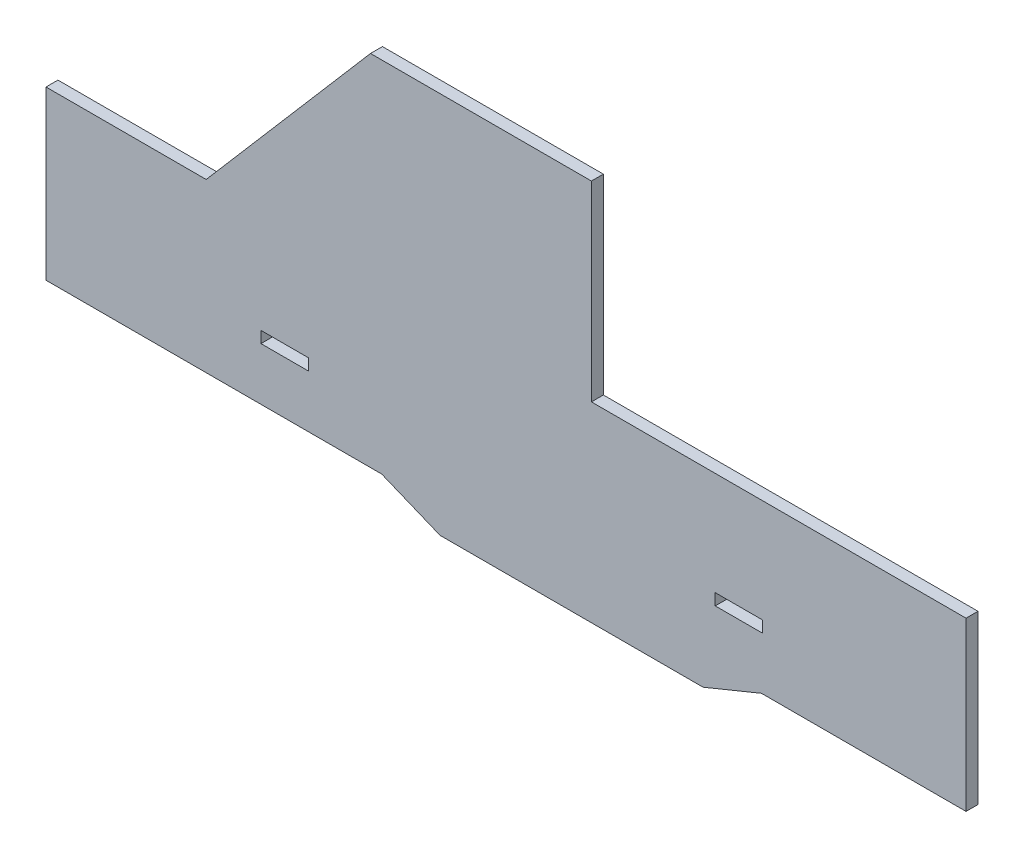
from build123d import *

# Parameters (mm, degrees)
MAIN_SIDE_DEPTH          = 3.175
SKETCH2_W                = 12.573
SKETCH2_H                = 3.048
BOTTOM_PLATE_HOLES_DEPTH = 229.888774204


with BuildPart() as part:
    # Sketch1 → Main Side (new body)
    with BuildSketch(Plane.XY):
        Polygon((62.123903317, 6.35), (131.966346795, 6.35), (147.472889282, 12.7), (201.808790274, 12.7), (201.808790274, 57.15), (102.314133739, 57.15), (102.314133739, 107.95), (43.639361702, 107.95), (0, 57.15), (-42.539209726, 57.15), (-42.539209726, 12.7), (46.617360741, 12.7), align=None)
    extrude(amount=MAIN_SIDE_DEPTH)

    # Sketch2 → Bottom Plate Holes (cut, through all)
    with BuildSketch(Plane.XY.offset(3.175)):
        with Locations((141.483790274, 28.194)):
            Rectangle(SKETCH2_W, SKETCH2_H)
        with Locations((20.833790274, 28.194)):
            Rectangle(SKETCH2_W, SKETCH2_H)
    extrude(amount=-BOTTOM_PLATE_HOLES_DEPTH, mode=Mode.SUBTRACT)


solid = part.part
